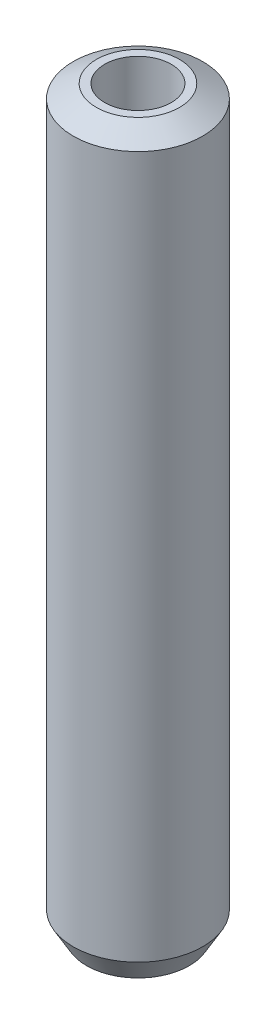
from build123d import *
from OCP.BRepFilletAPI import BRepFilletAPI_MakeChamfer

# Parameters (mm, degrees)
SKETCH1_R           = 20
BOSS_EXTRUDE1_DEPTH = 228.270910418
SKETCH2_R           = 10.280704431
CUT_EXTRUDE1_DEPTH  = 231.016539716
CHAMFER1_SIZE       = 4.121418054
CHAMFER1_SIZE2      = 7.138505469


with BuildPart() as part:
    # Sketch1 → Boss-Extrude1 (new body)
    with BuildSketch(Plane(origin=(0, 0, 0), x_dir=(1, 0, 0), z_dir=(0, 1, 0))):
        Circle(SKETCH1_R)
    extrude(amount=BOSS_EXTRUDE1_DEPTH)

    # Sketch2 → Cut-Extrude1 (cut, through all)
    with BuildSketch(Plane(origin=(0, 0, 0), x_dir=(1, 0, 0), z_dir=(0, 1, 0))):
        Circle(SKETCH2_R)
    extrude(amount=CUT_EXTRUDE1_DEPTH, mode=Mode.SUBTRACT)

    # Chamfer1: one chamfer whose edges measure the first distance from different faces: ONE call of the kernel's chamfer builder (chamfer() names one face for all edges)
    chamfer1_edges_1 = [part.edges().sort_by_distance(p)[0] for p in [
        (-20, 228.270910418, 0),
    ]]
    chamfer1_side_1 = [part.faces().sort_by_distance(p)[0] for p in [
        (-20, 114.135455209, 0),
    ]]
    chamfer1_edges_2 = [part.edges().sort_by_distance(p)[0] for p in [
        (-20, 0, 0),
    ]]
    chamfer1_side_2 = [part.faces().sort_by_distance(p)[0] for p in [
        (-19.434314575, 0, 0),
    ]]
    chamfer1 = BRepFilletAPI_MakeChamfer(part.part.solid().wrapped)
    for e in chamfer1_edges_1:
        chamfer1.Add(CHAMFER1_SIZE, CHAMFER1_SIZE2, e.wrapped, chamfer1_side_1[0].wrapped)  # the first distance lies on this face
    for e in chamfer1_edges_2:
        chamfer1.Add(CHAMFER1_SIZE, CHAMFER1_SIZE2, e.wrapped, chamfer1_side_2[0].wrapped)  # the first distance lies on this face
    add(Compound.cast(chamfer1.Shape()), mode=Mode.REPLACE)


solid = part.part
